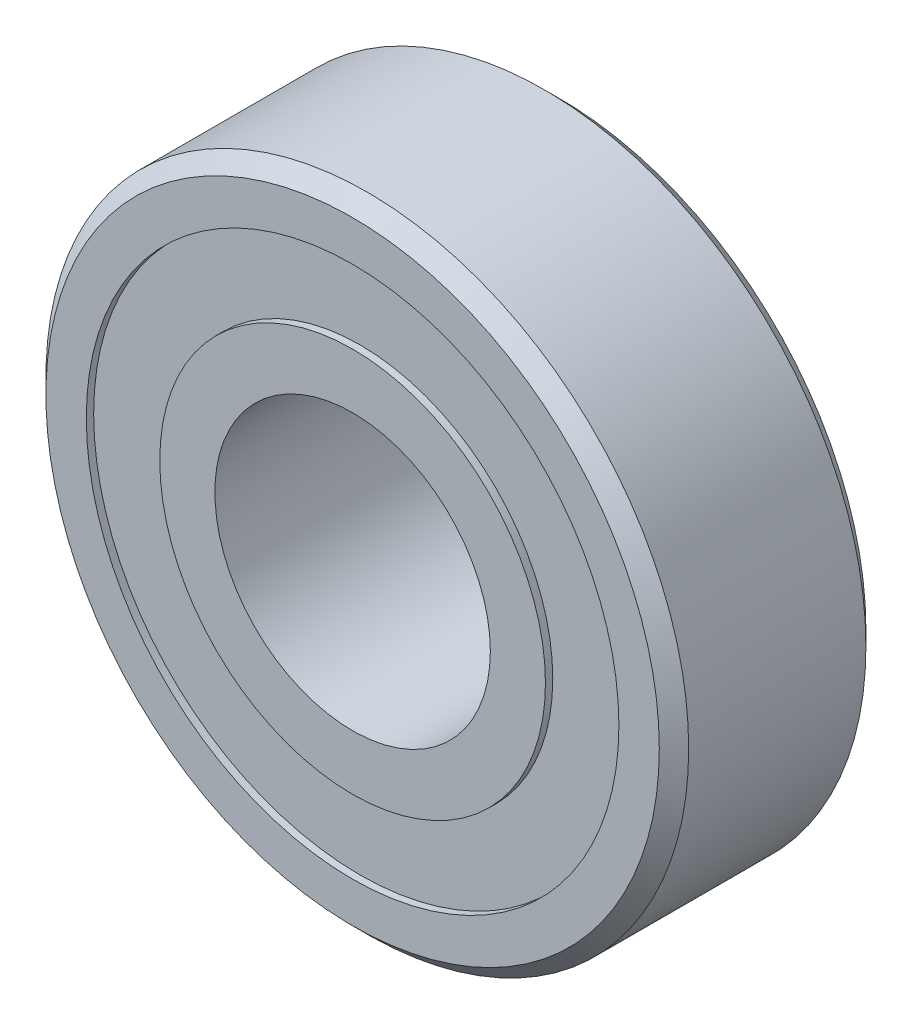
from build123d import *

# Parameters (mm, degrees)
SKETCH1_R                    = 11.1125
BOSS_EXTRUDE1_DEPTH          = 7.14375
CHAMFER1_SIZE                = 0.508
F_3_8_0_375_DIAMETER_HOLE1_D = 9.525
SKETCH5_R                    = 9.2075
SKETCH5_R_2                  = 6.6675
CUT_EXTRUDE1_DEPTH           = 0.254
CUT_EXTRUDE2_START           = -0.254
SKETCH6_R                    = 9.2075
SKETCH6_R_2                  = 6.6675
CUT_EXTRUDE2_DEPTH           = 0.254


with BuildPart() as part:
    # Sketch1 → Boss-Extrude1 (new body)
    with BuildSketch(Plane.XY):
        Circle(SKETCH1_R)
    extrude(amount=BOSS_EXTRUDE1_DEPTH)

    # Chamfer1
    chamfer1_edges = [part.edges().sort_by_distance(p)[0] for p in [
        (-11.1125, 0, 0),
        (-11.1125, 0, 7.14375),
    ]]
    chamfer(chamfer1_edges, length=CHAMFER1_SIZE)

    # 3/8 (0.375) Diameter Hole1 (through all)
    with Locations(Plane.XY.offset(7.14375)):
        with Locations((0, 0)):
            Hole(F_3_8_0_375_DIAMETER_HOLE1_D / 2)

    # Sketch5 → Cut-Extrude1 (cut)
    with BuildSketch(Plane.XY.offset(7.14375)):
        Circle(SKETCH5_R)
        Circle(SKETCH5_R_2, mode=Mode.SUBTRACT)
    extrude(amount=-CUT_EXTRUDE1_DEPTH, mode=Mode.SUBTRACT)

    # Sketch6 → Cut-Extrude2 (cut)
    with BuildSketch(Plane(origin=(0, 0, 0), x_dir=(-1, 0, 0), z_dir=(0, 0, -1)).offset(CUT_EXTRUDE2_START)):
        Circle(SKETCH6_R)
        Circle(SKETCH6_R_2, mode=Mode.SUBTRACT)
    extrude(amount=CUT_EXTRUDE2_DEPTH, mode=Mode.SUBTRACT)


solid = part.part
